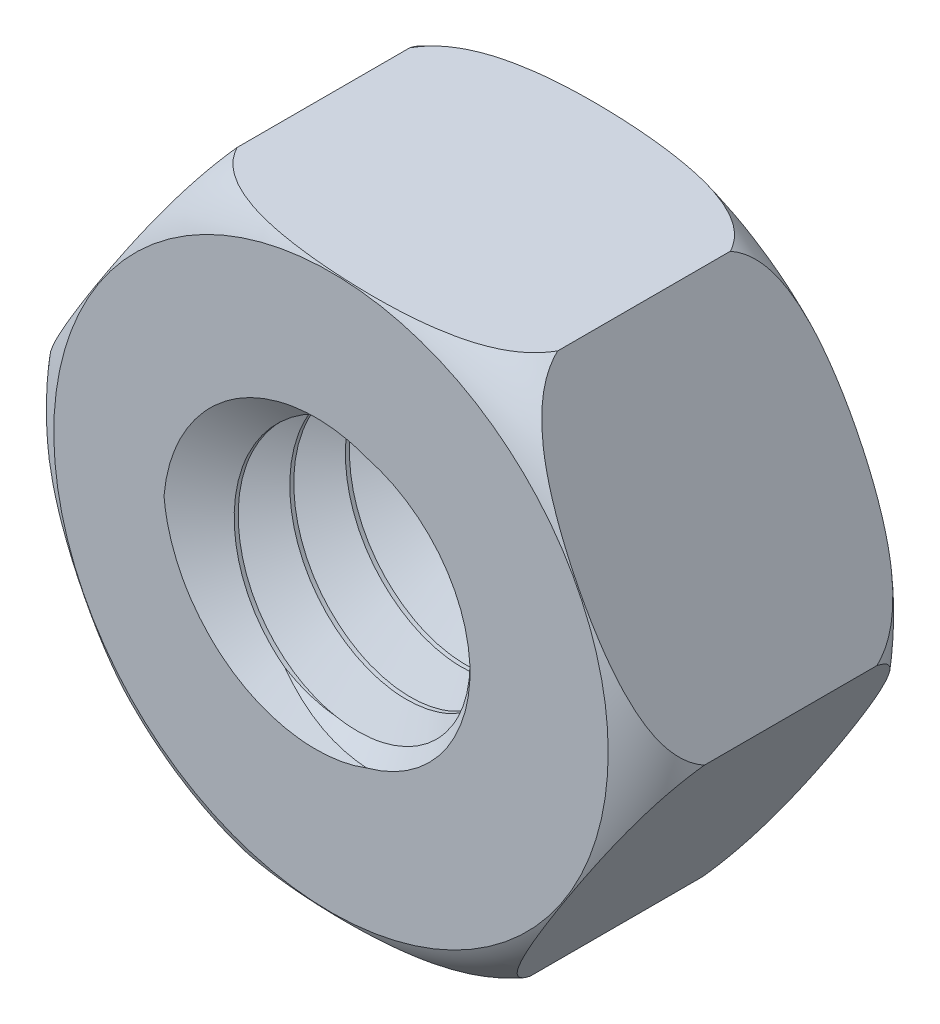
from build123d import *

# Parameters (mm, degrees)
BOSS_EXTRUDE1_DEPTH = 5
SKETCH11_R          = 2.2
CUT_EXTRUDE1_DEPTH  = 5
CHAMFER2_SIZE       = 0.3
CUT_SWEEP2_PITCH    = 1


with BuildPart() as part:
    # Sketch1 → Boss-Extrude1 (new body)
    with BuildSketch(Plane.XY):
        Polygon((-3.130487503, -4.851121657), (2.63595084, -5.136642532), (5.766438343, -0.285520875), (3.130487503, 4.851121657), (-2.63595084, 5.136642532), (-5.766438343, 0.285520875), align=None)
    extrude(amount=BOSS_EXTRUDE1_DEPTH)

    # Sketch6 → Cut-Revolve6 (revolve, cut)
    with BuildSketch(Plane(origin=(0, 0, 0), x_dir=(0, 0, -1), z_dir=(0.8896925845671811, 0.45656007815639066, 0))):
        with BuildLine():
            Line((0, 5.7859442), (-1, 5.7859442))
            add(Edge.make_bspline(
                [(0, 4.9859442), (-0.297420916, 5.628737898), (-1, 5.7859442)],
                knots=[0, 0, 0, 1, 1, 1], degree=2))
            Line((0, 4.9859442), (0, 5.7859442))
        make_face()
    cut_revolve6 = revolve(axis=Axis((0, 0, 0), (0, 0, -1)), mode=Mode.SUBTRACT)

    # Mirror1: Cut-Revolve6 across plane
    add(cut_revolve6.mirror(Plane(origin=(0, 0, 2.5), x_dir=(1, 0, 0), z_dir=(0, 0, -1))), mode=Mode.SUBTRACT)

    # Sketch11 → Cut-Extrude1 (cut)
    with BuildSketch(Plane(origin=(0, 0, 0), x_dir=(-1, 0, 0), z_dir=(0, 0, -1))):
        Circle(SKETCH11_R)
    extrude(amount=-CUT_EXTRUDE1_DEPTH, mode=Mode.SUBTRACT)

    # Chamfer2
    chamfer2_edges = [part.edges().sort_by_distance(p)[0] for p in [
        (2.2, 0, 5),
        (2.2, 0, 0),
    ]]
    chamfer(chamfer2_edges, length=CHAMFER2_SIZE)

    # Cut-Sweep2: the profile of Sketch13 screwed along a right-hand helix of 6 turns, 8 arcs to a turn; built about Z, then put on its axis
    cut_sweep2_z = Axis((0, 0, 0), (0, 0, 1))
    cut_sweep2_corners = [(2.198120302, 0, -0.465), (2.198120302, 0, 0.465), (3.003523928, 0, 0)]
    with BuildLine(mode=Mode.PRIVATE) as cut_sweep2_profile:
        Line(cut_sweep2_corners[0], cut_sweep2_corners[1])
        Line(cut_sweep2_corners[1], cut_sweep2_corners[2])
        Line(cut_sweep2_corners[2], cut_sweep2_corners[0])
    cut_sweep2_cap = Face(cut_sweep2_profile.wire())
    cut_sweep2_turn_angles = [0, 22.5, 45, 67.5, 90, 112.5, 135, 157.5, 180, 202.5, 225, 247.5, 270, 292.5, 315, 337.5, 360]
    cut_sweep2_turn_weights = [1, 0.9238795325112867, 1, 0.9238795325112867, 1, 0.9238795325112867, 1, 0.9238795325112867, 1, 0.9238795325112867, 1, 0.9238795325112867, 1, 0.9238795325112867, 1, 0.9238795325112867, 1]
    cut_sweep2_turn_rails = [Edge.make_bspline([Vector(p[0], p[1], 0).rotate(cut_sweep2_z, cut_sweep2_turn_angles[k]) / cut_sweep2_turn_weights[k] + Vector(0, 0, p[2] + CUT_SWEEP2_PITCH * cut_sweep2_turn_angles[k] / 360) for k in range(17)], [0, 0, 0, 1, 1, 2, 2, 3, 3, 4, 4, 5, 5, 6, 6, 7, 7, 8, 8, 8], 2, cut_sweep2_turn_weights) for p in cut_sweep2_corners]
    cut_sweep2_turn_sides = [Face.make_surface_from_curves(cut_sweep2_turn_rails[p[0]], cut_sweep2_turn_rails[p[1]]) for p in [(0, 1), (1, 2), (2, 0)]]
    cut_sweep2 = Plane(origin=(0, 0, 0), x_dir=(-1, 0, 0), z_dir=(0, 0, 1)) * Solid(Shell([*[p.moved(Location((0, 0, CUT_SWEEP2_PITCH * i))) for i in range(6) for p in cut_sweep2_turn_sides], cut_sweep2_cap, cut_sweep2_cap.rotate(cut_sweep2_z, 2160).moved(Location((0, 0, CUT_SWEEP2_PITCH * 2160 / 360)))]))
    add(cut_sweep2, mode=Mode.SUBTRACT)


solid = part.part
